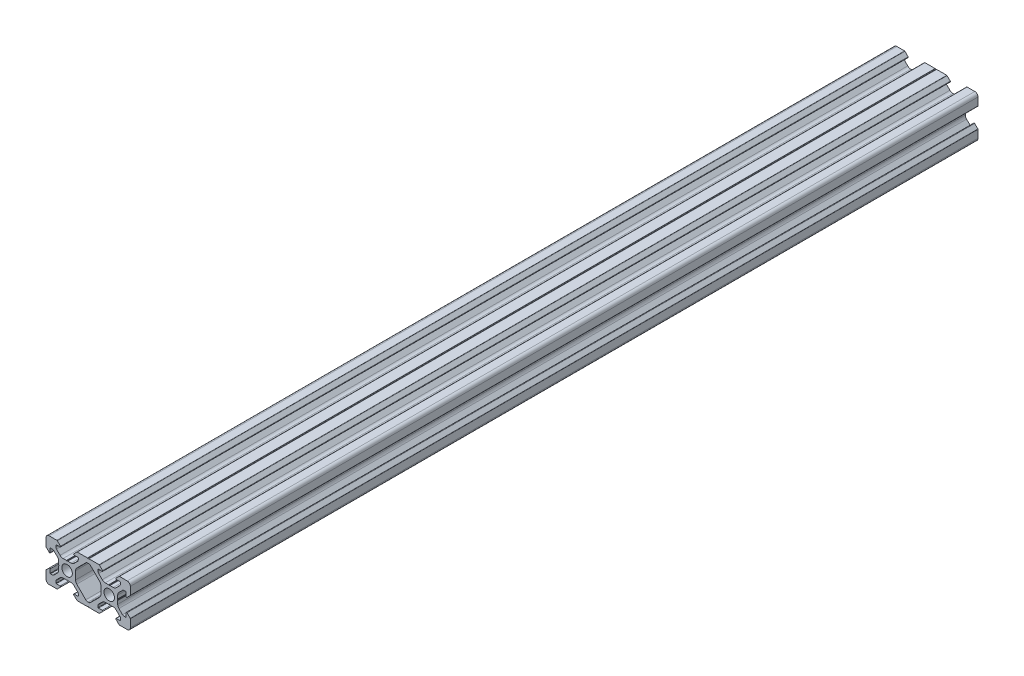
from build123d import *

# Parameters (mm, degrees)
MODEL_R                         = 2.5
BODY_DEPTH                      = 402
TAP_DRILL_FOR_M6X1_0_TAP1_D     = 5
TAP_DRILL_FOR_M6X1_0_TAP1_DEPTH = 13.497848452
TAP_DRILL_FOR_M6X1_0_TAP1_TIP   = 1.502151548


with BuildPart() as part:
    # Model → Body (new body)
    with BuildSketch(Plane.XY):
        with BuildLine():
            Line((0.375693909, 9.662304735), (5.17, 9.662304735))
            ThreePointArc((5.17, 9.662304735), (5.265670858, 9.643274618), (5.346776695, 9.58908143))
            Line((5.346776695, 9.58908143), (6.846776695, 8.08908143))
            ThreePointArc((6.846776695, 8.08908143), (6.900969883, 7.816633877), (6.67, 7.662304735))
            Line((6.67, 7.662304735), (4.9, 7.662304735))
            ThreePointArc((4.9, 7.662304735), (4.758578644, 7.603726091), (4.7, 7.462304735))
            Line((4.7, 7.462304735), (4.7, 6.649310504))
            ThreePointArc((4.7, 6.649310504), (4.776120467, 6.266627071), (4.992893219, 5.942203722))
            Line((4.992893219, 5.942203722), (6.687005769, 4.248091173))
            ThreePointArc((6.687005769, 4.248091173), (7.335852466, 3.81454567), (8.101219331, 3.662304735))
            Line((8.101219331, 3.662304735), (9.662304735, 3.662304735))
            ThreePointArc((9.662304735, 3.662304735), (9.745056471, 3.648211815), (9.818478497, 3.607521938))
            Line((9.818478497, 3.607521938), (10, 3.462304735))
            Line((10, 3.462304735), (10.181521503, 3.607521938))
            ThreePointArc((10.181521503, 3.607521938), (10.254943529, 3.648211815), (10.337695265, 3.662304735))
            Line((10.337695265, 3.662304735), (11.898780669, 3.662304735))
            ThreePointArc((11.898780669, 3.662304735), (12.664147534, 3.81454567), (13.312994231, 4.248091173))
            Line((13.312994231, 4.248091173), (15.007106781, 5.942203722))
            ThreePointArc((15.007106781, 5.942203722), (15.223879533, 6.266627071), (15.3, 6.649310504))
            Line((15.3, 6.649310504), (15.3, 7.462304735))
            ThreePointArc((15.3, 7.462304735), (15.241421356, 7.603726091), (15.1, 7.662304735))
            Line((15.1, 7.662304735), (13.33, 7.662304735))
            ThreePointArc((13.33, 7.662304735), (13.099030117, 7.816633877), (13.153223305, 8.08908143))
            Line((13.153223305, 8.08908143), (14.653223305, 9.58908143))
            ThreePointArc((14.653223305, 9.58908143), (14.734329142, 9.643274618), (14.83, 9.662304735))
            Line((14.83, 9.662304735), (18.5, 9.662304735))
            ThreePointArc((18.5, 9.662304735), (19.560660172, 9.222964907), (20, 8.162304735))
            Line((20, 8.162304735), (20, 4.492304735))
            ThreePointArc((20, 4.492304735), (19.980969883, 4.396633877), (19.926776695, 4.31552804))
            Line((19.926776695, 4.31552804), (18.426776695, 2.81552804))
            ThreePointArc((18.426776695, 2.81552804), (18.154329142, 2.761334852), (18, 2.992304735))
            Line((18, 2.992304735), (18, 4.762304735))
            ThreePointArc((18, 4.762304735), (17.941421356, 4.903726091), (17.8, 4.962304735))
            Line((17.8, 4.962304735), (16.987005769, 4.962304735))
            ThreePointArc((16.987005769, 4.962304735), (16.604322336, 4.886184268), (16.279898987, 4.669411516))
            Line((16.279898987, 4.669411516), (14.585786438, 2.975298967))
            ThreePointArc((14.585786438, 2.975298967), (14.152240935, 2.326452269), (14, 1.561085404))
            Line((14, 1.561085404), (14, 0))
            ThreePointArc((14, 0), (13.98590708, -0.082751735), (13.945217202, -0.156173762))
            Line((13.945217202, -0.156173762), (13.8, -0.337695265))
            Line((13.8, -0.337695265), (13.945217202, -0.519216768))
            ThreePointArc((13.945217202, -0.519216768), (13.98590708, -0.592638794), (14, -0.67539053))
            Line((14, -0.67539053), (14, -2.236475934))
            ThreePointArc((14, -2.236475934), (14.152240935, -3.001842799), (14.585786438, -3.650689496))
            Line((14.585786438, -3.650689496), (16.279898987, -5.344802046))
            ThreePointArc((16.279898987, -5.344802046), (16.604322336, -5.561574797), (16.987005769, -5.637695265))
            Line((16.987005769, -5.637695265), (17.8, -5.637695265))
            ThreePointArc((17.8, -5.637695265), (17.941421356, -5.579116621), (18, -5.437695265))
            Line((18, -5.437695265), (18, -3.667695265))
            ThreePointArc((18, -3.667695265), (18.154329142, -3.436725382), (18.426776695, -3.49091857))
            Line((18.426776695, -3.49091857), (19.926776695, -4.99091857))
            ThreePointArc((19.926776695, -4.99091857), (19.980969883, -5.072024407), (20, -5.167695265))
            Line((20, -5.167695265), (20, -8.837695265))
            ThreePointArc((20, -8.837695265), (19.560660172, -9.898355437), (18.5, -10.337695265))
            Line((18.5, -10.337695265), (14.83, -10.337695265))
            ThreePointArc((14.83, -10.337695265), (14.734329142, -10.318665148), (14.653223305, -10.26447196))
            Line((14.653223305, -10.26447196), (13.153223305, -8.76447196))
            ThreePointArc((13.153223305, -8.76447196), (13.099030117, -8.492024407), (13.33, -8.337695265))
            Line((13.33, -8.337695265), (15.1, -8.337695265))
            ThreePointArc((15.1, -8.337695265), (15.241421356, -8.279116621), (15.3, -8.137695265))
            Line((15.3, -8.137695265), (15.3, -7.324701033))
            ThreePointArc((15.3, -7.324701033), (15.223879533, -6.942017601), (15.007106781, -6.617594252))
            Line((15.007106781, -6.617594252), (13.312994231, -4.923481702))
            ThreePointArc((13.312994231, -4.923481702), (12.664147534, -4.4899362), (11.898780669, -4.337695265))
            Line((11.898780669, -4.337695265), (10.337695265, -4.337695265))
            ThreePointArc((10.337695265, -4.337695265), (10.254943529, -4.323602345), (10.181521503, -4.282912467))
            Line((10.181521503, -4.282912467), (10, -4.137695265))
            Line((10, -4.137695265), (9.818478497, -4.282912467))
            ThreePointArc((9.818478497, -4.282912467), (9.745056471, -4.323602345), (9.662304735, -4.337695265))
            Line((9.662304735, -4.337695265), (8.101219331, -4.337695265))
            ThreePointArc((8.101219331, -4.337695265), (7.335852466, -4.4899362), (6.687005769, -4.923481702))
            Line((6.687005769, -4.923481702), (4.992893219, -6.617594252))
            ThreePointArc((4.992893219, -6.617594252), (4.776120467, -6.942017601), (4.7, -7.324701033))
            Line((4.7, -7.324701033), (4.7, -8.137695265))
            ThreePointArc((4.7, -8.137695265), (4.758578644, -8.279116621), (4.9, -8.337695265))
            Line((4.9, -8.337695265), (6.67, -8.337695265))
            ThreePointArc((6.67, -8.337695265), (6.900969883, -8.492024407), (6.846776695, -8.76447196))
            Line((6.846776695, -8.76447196), (5.346776695, -10.26447196))
            ThreePointArc((5.346776695, -10.26447196), (5.265670858, -10.318665148), (5.17, -10.337695265))
            Line((5.17, -10.337695265), (0.375693909, -10.337695265))
            ThreePointArc((0.375693909, -10.337695265), (0.303247872, -10.326968271), (0.23701886, -10.295707838))
            Line((0.23701886, -10.295707838), (0, -10.137695265))
            Line((0, -10.137695265), (-0.23701886, -10.295707838))
            ThreePointArc((-0.23701886, -10.295707838), (-0.303247872, -10.326968271), (-0.375693909, -10.337695265))
            Line((-0.375693909, -10.337695265), (-5.17, -10.337695265))
            ThreePointArc((-5.17, -10.337695265), (-5.265670858, -10.318665148), (-5.346776695, -10.26447196))
            Line((-5.346776695, -10.26447196), (-6.846776695, -8.76447196))
            ThreePointArc((-6.846776695, -8.76447196), (-6.900969883, -8.492024407), (-6.67, -8.337695265))
            Line((-6.67, -8.337695265), (-4.9, -8.337695265))
            ThreePointArc((-4.9, -8.337695265), (-4.758578644, -8.279116621), (-4.7, -8.137695265))
            Line((-4.7, -8.137695265), (-4.7, -7.324701033))
            ThreePointArc((-4.7, -7.324701033), (-4.776120467, -6.942017601), (-4.992893219, -6.617594252))
            Line((-4.992893219, -6.617594252), (-6.687005769, -4.923481702))
            ThreePointArc((-6.687005769, -4.923481702), (-7.335852466, -4.4899362), (-8.101219331, -4.337695265))
            Line((-8.101219331, -4.337695265), (-9.662304735, -4.337695265))
            ThreePointArc((-9.662304735, -4.337695265), (-9.745056471, -4.323602345), (-9.818478497, -4.282912467))
            Line((-9.818478497, -4.282912467), (-10, -4.137695265))
            Line((-10, -4.137695265), (-10.181521503, -4.282912467))
            ThreePointArc((-10.181521503, -4.282912467), (-10.254943529, -4.323602345), (-10.337695265, -4.337695265))
            Line((-10.337695265, -4.337695265), (-11.898780669, -4.337695265))
            ThreePointArc((-11.898780669, -4.337695265), (-12.664147534, -4.4899362), (-13.312994231, -4.923481702))
            Line((-13.312994231, -4.923481702), (-15.007106781, -6.617594252))
            ThreePointArc((-15.007106781, -6.617594252), (-15.223879533, -6.942017601), (-15.3, -7.324701033))
            Line((-15.3, -7.324701033), (-15.3, -8.137695265))
            ThreePointArc((-15.3, -8.137695265), (-15.241421356, -8.279116621), (-15.1, -8.337695265))
            Line((-15.1, -8.337695265), (-13.33, -8.337695265))
            ThreePointArc((-13.33, -8.337695265), (-13.099030117, -8.492024407), (-13.153223305, -8.76447196))
            Line((-13.153223305, -8.76447196), (-14.653223305, -10.26447196))
            ThreePointArc((-14.653223305, -10.26447196), (-14.734329142, -10.318665148), (-14.83, -10.337695265))
            Line((-14.83, -10.337695265), (-18.5, -10.337695265))
            ThreePointArc((-18.5, -10.337695265), (-19.560660172, -9.898355437), (-20, -8.837695265))
            Line((-20, -8.837695265), (-20, -5.167695265))
            ThreePointArc((-20, -5.167695265), (-19.980969883, -5.072024407), (-19.926776695, -4.99091857))
            Line((-19.926776695, -4.99091857), (-18.426776695, -3.49091857))
            ThreePointArc((-18.426776695, -3.49091857), (-18.154329142, -3.436725382), (-18, -3.667695265))
            Line((-18, -3.667695265), (-18, -5.437695265))
            ThreePointArc((-18, -5.437695265), (-17.941421356, -5.579116621), (-17.8, -5.637695265))
            Line((-17.8, -5.637695265), (-16.987005769, -5.637695265))
            ThreePointArc((-16.987005769, -5.637695265), (-16.604322336, -5.561574797), (-16.279898987, -5.344802046))
            Line((-16.279898987, -5.344802046), (-14.585786438, -3.650689496))
            ThreePointArc((-14.585786438, -3.650689496), (-14.152240935, -3.001842799), (-14, -2.236475934))
            Line((-14, -2.236475934), (-14, -0.67539053))
            ThreePointArc((-14, -0.67539053), (-13.98590708, -0.592638794), (-13.945217202, -0.519216768))
            Line((-13.945217202, -0.519216768), (-13.8, -0.337695265))
            Line((-13.8, -0.337695265), (-13.945217202, -0.156173762))
            ThreePointArc((-13.945217202, -0.156173762), (-13.98590708, -0.082751735), (-14, 0))
            Line((-14, 0), (-14, 1.561085404))
            ThreePointArc((-14, 1.561085404), (-14.152240935, 2.326452269), (-14.585786438, 2.975298967))
            Line((-14.585786438, 2.975298967), (-16.279898987, 4.669411516))
            ThreePointArc((-16.279898987, 4.669411516), (-16.604322336, 4.886184268), (-16.987005769, 4.962304735))
            Line((-16.987005769, 4.962304735), (-17.8, 4.962304735))
            ThreePointArc((-17.8, 4.962304735), (-17.941421356, 4.903726091), (-18, 4.762304735))
            Line((-18, 4.762304735), (-18, 2.992304735))
            ThreePointArc((-18, 2.992304735), (-18.154329142, 2.761334852), (-18.426776695, 2.81552804))
            Line((-18.426776695, 2.81552804), (-19.926776695, 4.31552804))
            ThreePointArc((-19.926776695, 4.31552804), (-19.980969883, 4.396633877), (-20, 4.492304735))
            Line((-20, 4.492304735), (-20, 8.162304735))
            ThreePointArc((-20, 8.162304735), (-19.560660172, 9.222964907), (-18.5, 9.662304735))
            Line((-18.5, 9.662304735), (-14.83, 9.662304735))
            ThreePointArc((-14.83, 9.662304735), (-14.734329142, 9.643274618), (-14.653223305, 9.58908143))
            Line((-14.653223305, 9.58908143), (-13.153223305, 8.08908143))
            ThreePointArc((-13.153223305, 8.08908143), (-13.099030117, 7.816633877), (-13.33, 7.662304735))
            Line((-13.33, 7.662304735), (-15.1, 7.662304735))
            ThreePointArc((-15.1, 7.662304735), (-15.241421356, 7.603726091), (-15.3, 7.462304735))
            Line((-15.3, 7.462304735), (-15.3, 6.649310504))
            ThreePointArc((-15.3, 6.649310504), (-15.223879533, 6.266627071), (-15.007106781, 5.942203722))
            Line((-15.007106781, 5.942203722), (-13.312994231, 4.248091173))
            ThreePointArc((-13.312994231, 4.248091173), (-12.664147534, 3.81454567), (-11.898780669, 3.662304735))
            Line((-11.898780669, 3.662304735), (-10.337695265, 3.662304735))
            ThreePointArc((-10.337695265, 3.662304735), (-10.254943529, 3.648211815), (-10.181521503, 3.607521938))
            Line((-10.181521503, 3.607521938), (-10, 3.462304735))
            Line((-10, 3.462304735), (-9.818478497, 3.607521938))
            ThreePointArc((-9.818478497, 3.607521938), (-9.745056471, 3.648211815), (-9.662304735, 3.662304735))
            Line((-9.662304735, 3.662304735), (-8.101219331, 3.662304735))
            ThreePointArc((-8.101219331, 3.662304735), (-7.335852466, 3.81454567), (-6.687005769, 4.248091173))
            Line((-6.687005769, 4.248091173), (-4.992893219, 5.942203722))
            ThreePointArc((-4.992893219, 5.942203722), (-4.776120467, 6.266627071), (-4.7, 6.649310504))
            Line((-4.7, 6.649310504), (-4.7, 7.462304735))
            ThreePointArc((-4.7, 7.462304735), (-4.758578644, 7.603726091), (-4.9, 7.662304735))
            Line((-4.9, 7.662304735), (-6.67, 7.662304735))
            ThreePointArc((-6.67, 7.662304735), (-6.900969883, 7.816633877), (-6.846776695, 8.08908143))
            Line((-6.846776695, 8.08908143), (-5.346776695, 9.58908143))
            ThreePointArc((-5.346776695, 9.58908143), (-5.265670858, 9.643274618), (-5.17, 9.662304735))
            Line((-5.17, 9.662304735), (-0.375693909, 9.662304735))
            ThreePointArc((-0.375693909, 9.662304735), (-0.303247872, 9.651577742), (-0.23701886, 9.620317309))
            Line((-0.23701886, 9.620317309), (0, 9.462304735))
            Line((0, 9.462304735), (0.23701886, 9.620317309))
            ThreePointArc((0.23701886, 9.620317309), (0.303247872, 9.651577742), (0.375693909, 9.662304735))
        make_face()
        with Locations((10, -0.337695265)):
            Circle(MODEL_R, mode=Mode.SUBTRACT)
        with Locations((-10, -0.337695265)):
            Circle(MODEL_R, mode=Mode.SUBTRACT)
        with BuildLine():
            Line((-5.414213562, 2.975298967), (-1.1372583, 7.252254229))
            ThreePointArc((-1.1372583, 7.252254229), (-0.683065612, 7.555736081), (-0.147308807, 7.662304735))
            Line((-0.147308807, 7.662304735), (0.147308807, 7.662304735))
            ThreePointArc((0.147308807, 7.662304735), (0.683065612, 7.555736081), (1.1372583, 7.252254229))
            Line((1.1372583, 7.252254229), (5.414213562, 2.975298967))
            ThreePointArc((5.414213562, 2.975298967), (5.847759065, 2.326452269), (6, 1.561085404))
            Line((6, 1.561085404), (6, -2.236475934))
            ThreePointArc((6, -2.236475934), (5.847759065, -3.001842799), (5.414213562, -3.650689496))
            Line((5.414213562, -3.650689496), (1.1372583, -7.927644759))
            ThreePointArc((1.1372583, -7.927644759), (0.683065612, -8.23112661), (0.147308807, -8.337695265))
            Line((0.147308807, -8.337695265), (-0.147308807, -8.337695265))
            ThreePointArc((-0.147308807, -8.337695265), (-0.683065612, -8.23112661), (-1.1372583, -7.927644759))
            Line((-1.1372583, -7.927644759), (-5.414213562, -3.650689496))
            ThreePointArc((-5.414213562, -3.650689496), (-5.847759065, -3.001842799), (-6, -2.236475934))
            Line((-6, -2.236475934), (-6, 1.561085404))
            ThreePointArc((-6, 1.561085404), (-5.847759065, 2.326452269), (-5.414213562, 2.975298967))
        make_face(mode=Mode.SUBTRACT)
    extrude(amount=BODY_DEPTH)

    # Tap Drill for M6x1.0 Tap1
    with Locations(Plane.XY.offset(402)):
        with Locations((-10, -0.337695265), (10, -0.337695265)):
            Hole(TAP_DRILL_FOR_M6X1_0_TAP1_D / 2, depth=TAP_DRILL_FOR_M6X1_0_TAP1_DEPTH)
            with Locations((0, 0, -(TAP_DRILL_FOR_M6X1_0_TAP1_DEPTH + TAP_DRILL_FOR_M6X1_0_TAP1_TIP / 2))):  # 118° drill point
                Cone(0, TAP_DRILL_FOR_M6X1_0_TAP1_D / 2, TAP_DRILL_FOR_M6X1_0_TAP1_TIP, mode=Mode.SUBTRACT)


solid = part.part
